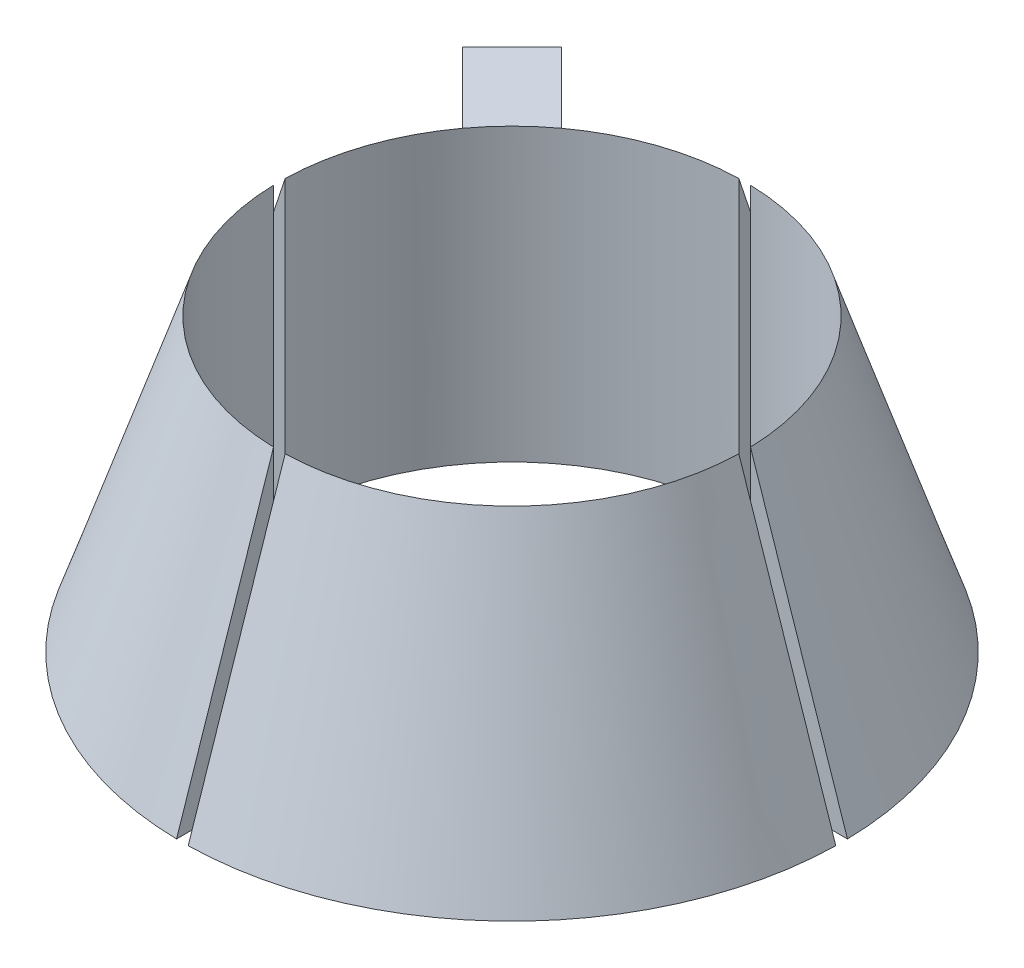
from build123d import *

# Parameters (mm, degrees)
SKETCH2_W           = 25.018752931
SKETCH2_H           = 3
SKETCH2_W_2         = 3
SKETCH2_H_2         = 25.018752931
CUT_EXTRUDE1_DEPTH  = 142.686273153
BOSS_EXTRUDE1_DEPTH = 75


# Read off the part's stored shape, not the designer's step: Ø5.0 (5) Diameter Hole1
with BuildPart() as part:
    # Sketch1 → Revolve1 (revolve)
    with BuildSketch(Plane.XY, mode=Mode.PRIVATE) as revolve1_sk:
        Polygon((60, 75), (60, 0), (85, 0), align=None)
    revolve(revolve1_sk.sketch.rotate(Axis((0, 0, 0), (0, 1, 0)), 90), axis=Axis((0, 0, 0), (0, 1, 0)))

    # Sketch2 → Cut-Extrude1 (cut, through all)
    with BuildSketch(Plane.XZ):
        with Locations((72.490623535, 0)):
            Rectangle(SKETCH2_W, SKETCH2_H)
        with Locations((0, -72.490623535)):
            Rectangle(SKETCH2_W_2, SKETCH2_H_2)
        with Locations((-72.490623535, 0)):
            Rectangle(SKETCH2_W, SKETCH2_H)
        with Locations((0, 72.490623535)):
            Rectangle(SKETCH2_W_2, SKETCH2_H_2)
    extrude(amount=-CUT_EXTRUDE1_DEPTH, mode=Mode.SUBTRACT)


with BuildPart() as cut_extrude1_piece_1:
    # of the separate pieces the step leaves, piece 1, a body of its own (cut_extrude1_pieces)
    add(part.part.solids().sort_by_distance((1.5, 75, 59.981247069))[0])


with BuildPart() as cut_extrude1_piece_2:
    # of the separate pieces the step leaves, piece 2, a body of its own (cut_extrude1_pieces)
    add(part.part.solids().sort_by_distance((59.981247069, 75, -1.5))[0])


with BuildPart() as cut_extrude1_piece_3:
    # of the separate pieces the step leaves, piece 3, a body of its own (cut_extrude1_pieces)
    add(part.part.solids().sort_by_distance((-59.981247069, 0, 1.5))[0])


with BuildPart() as cut_extrude1_piece_4:
    # of the separate pieces the step leaves, piece 4, a body of its own (cut_extrude1_pieces)
    add(part.part.solids().sort_by_distance((-1.5, 0, -59.981247069))[0])

    # Sketch3 → Boss-Extrude1 (add)
    with BuildSketch(Plane.XZ):
        with BuildLine():
            Line((-66.468037432, -53.74011537), (-53.74011537, -66.468037432))
            Line((-53.74011537, -66.468037432), (-35.582433332, -48.310355393))
            ThreePointArc((-35.582433332, -48.310355393), (-42.426406871, -42.426406871), (-48.310355393, -35.582433332))
            Line((-48.310355393, -35.582433332), (-66.468037432, -53.74011537))
        make_face()
    extrude(amount=-BOSS_EXTRUDE1_DEPTH)

    # Ø5.0 (5) Diameter Hole1 outline → Ø5.0 (5) Diameter Hole1 (revolve, cut)
    with BuildSketch(Plane(origin=(0, 23.5, 0), x_dir=(0.7071067811865471, 0, -0.707106781186548), z_dir=(0, -1, 0))):
        Polygon((2.5, -62.502151548), (0, -61), (0, -85), (2.525, -85), (2.5, -84.975), align=None)
    revolve(axis=Axis((0, 23.5, 0), (0.707106781186548, 0, 0.7071067811865471)), mode=Mode.SUBTRACT)

    # 5.0 _5_ Diameter Hole1 2 outline → 5.0 _5_ Diameter Hole1 2 (revolve, cut)
    with BuildSketch(Plane(origin=(0, 51.5, 0), x_dir=(0.7071067811865471, 0, -0.707106781186548), z_dir=(0, -1, 0))):
        Polygon((2.5, -62.502151548), (0, -61), (0, -85), (2.525, -85), (2.5, -84.975), align=None)
    revolve(axis=Axis((0, 51.5, 0), (0.707106781186548, 0, 0.7071067811865471)), mode=Mode.SUBTRACT)


solid = Compound([cut_extrude1_piece_1.part, cut_extrude1_piece_2.part, cut_extrude1_piece_3.part, cut_extrude1_piece_4.part])
